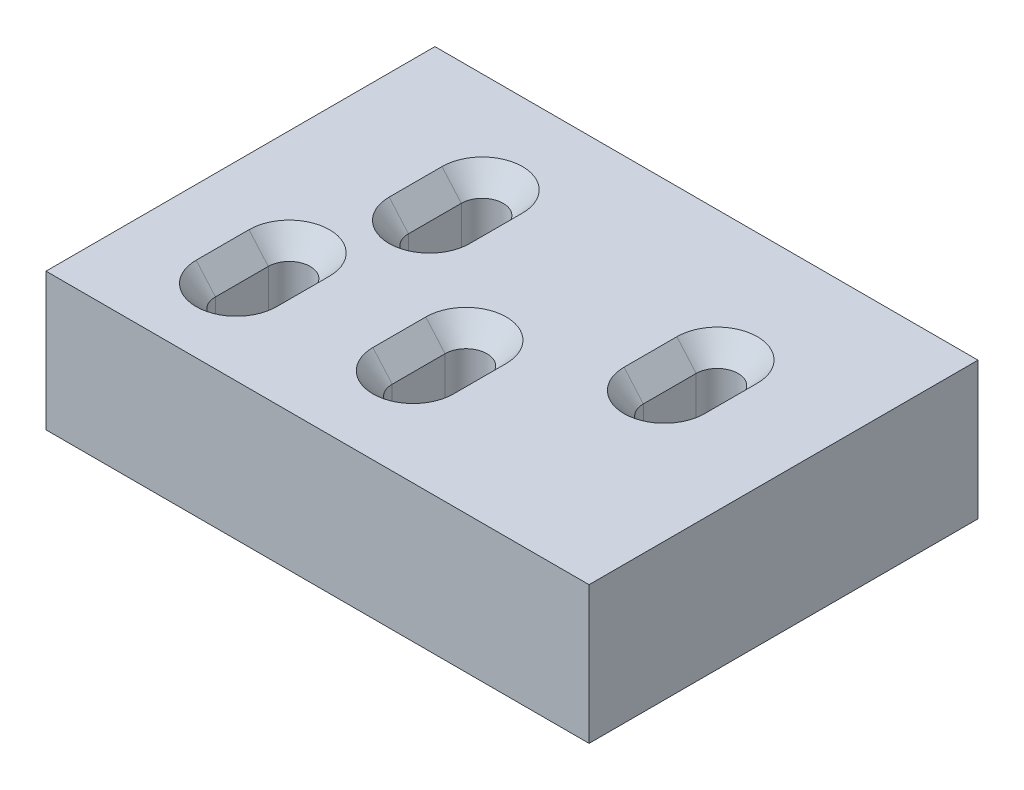
from build123d import *

# Parameters (mm, degrees)
SKETCH1_W                                      = 130.554298298
SKETCH1_H                                      = 93.497401401
BOSS_EXTRUDE1_DEPTH                            = 33.046022073
CSK_SLOT_FOR_3_8_FLAT_HEAD_MACHINE_SCREW_DEPTH = 33.046022073


with BuildPart() as part:
    # Sketch1 → Boss-Extrude1 (new body)
    with BuildSketch(Plane(origin=(0, 0, 0), x_dir=(1, 0, 0), z_dir=(0, 1, 0))):
        with Locations((65.277149149, 46.748700701)):
            Rectangle(SKETCH1_W, SKETCH1_H)
    extrude(amount=BOSS_EXTRUDE1_DEPTH)

    # CSK SLOT for 3/8 Flat Head Machine Screw1: read off the stored shape, not the designer's step
    # CSK SLOT for 3_8 Flat Head Machine S 2 → CSK SLOT for 3/8 Flat Head Machine Screw1 (cut)
    with BuildSketch(Plane(origin=(0, 0, 0), x_dir=(1, 0, 0), z_dir=(0, 1, 0))):
        with BuildLine():
            Line((30.486575013, 20.328472109), (30.486575013, 33.028472109))
            ThreePointArc((30.486575013, 33.028472109), (25.444675013, 38.070372109), (20.402775013, 33.028472109))
            Line((20.402775013, 33.028472109), (20.402775013, 20.328472109))
            ThreePointArc((20.402775013, 20.328472109), (25.444675013, 15.286572109), (30.486575013, 20.328472109))
        make_face()
        with BuildLine():
            Line((69.908405086, 23.408302584), (69.908405086, 36.108302584))
            ThreePointArc((69.908405086, 36.108302584), (64.866505086, 41.150202584), (59.824605086, 36.108302584))
            Line((59.824605086, 36.108302584), (59.824605086, 23.408302584))
            ThreePointArc((59.824605086, 23.408302584), (64.866505086, 18.366402584), (69.908405086, 23.408302584))
        make_face()
        with BuildLine():
            Line((104.197184368, 49.4842006), (104.197184368, 62.1842006))
            ThreePointArc((104.197184368, 62.1842006), (99.155284368, 67.2261006), (94.113384368, 62.1842006))
            Line((94.113384368, 62.1842006), (94.113384368, 49.4842006))
            ThreePointArc((94.113384368, 49.4842006), (99.155284368, 44.4423006), (104.197184368, 49.4842006))
        make_face()
        with BuildLine():
            Line((40.547354563, 56.670471707), (40.547354563, 69.370471707))
            ThreePointArc((40.547354563, 69.370471707), (35.505454563, 74.412371707), (30.463554563, 69.370471707))
            Line((30.463554563, 69.370471707), (30.463554563, 56.670471707))
            ThreePointArc((30.463554563, 56.670471707), (35.505454563, 51.628571707), (40.547354563, 56.670471707))
        make_face()
    extrude(amount=CSK_SLOT_FOR_3_8_FLAT_HEAD_MACHINE_SCREW_DEPTH, mode=Mode.SUBTRACT)

    # CSK SLOT for 3_8 Flat Head Machine S 3: loft between two sections, ruled curve by curve
    csk_slot_for_3_8_flat_head_machine_s_3_from = [
        Edge.make_three_point_arc((30.486575013, 27.713489321, -33.028472109), (29.009836693, 27.713489321, -36.593633789), (25.444675013, 27.713489321, -38.070372109)),
        Edge.make_three_point_arc((25.444675013, 27.713489321, -38.070372109), (21.879513333, 27.713489321, -36.593633789), (20.402775013, 27.713489321, -33.028472109)),
        Edge.make_three_point_arc((20.402775013, 27.713489321, -20.328472109), (21.879513333, 27.713489321, -16.763310429), (25.444675013, 27.713489321, -15.286572109)),
        Edge.make_three_point_arc((25.444675013, 27.713489321, -15.286572109), (29.009836693, 27.713489321, -16.763310429), (30.486575013, 27.713489321, -20.328472109)),
        Edge.make_line((20.402775013, 27.713489321, -33.028472109), (20.402775013, 27.713489321, -20.328472109)),
        Edge.make_line((30.486575013, 27.713489321, -33.028472109), (30.486575013, 27.713489321, -20.328472109)),
    ]
    csk_slot_for_3_8_flat_head_machine_s_3_to = [
        Edge.make_three_point_arc((35.122075013, 33.046022073, -33.028472109), (32.287630178, 33.046022073, -39.871427273), (25.444675013, 33.046022073, -42.705872109)),
        Edge.make_three_point_arc((25.444675013, 33.046022073, -42.705872109), (18.601719849, 33.046022073, -39.871427273), (15.767275013, 33.046022073, -33.028472109)),
        Edge.make_three_point_arc((15.767275013, 33.046022073, -20.328472109), (18.601719849, 33.046022073, -13.485516945), (25.444675013, 33.046022073, -10.651072109)),
        Edge.make_three_point_arc((25.444675013, 33.046022073, -10.651072109), (32.287630178, 33.046022073, -13.485516945), (35.122075013, 33.046022073, -20.328472109)),
        Edge.make_line((15.767275013, 33.046022073, -33.028472109), (15.767275013, 33.046022073, -20.328472109)),
        Edge.make_line((35.122075013, 33.046022073, -33.028472109), (35.122075013, 33.046022073, -20.328472109)),
    ]
    csk_slot_for_3_8_flat_head_machine_s_3 = Solid(Shell([*[Face.make_surface_from_curves(csk_slot_for_3_8_flat_head_machine_s_3_from[k], csk_slot_for_3_8_flat_head_machine_s_3_to[k]) for k in range(6)], Face(Wire(csk_slot_for_3_8_flat_head_machine_s_3_from)), Face(Wire(csk_slot_for_3_8_flat_head_machine_s_3_to))]))
    add(csk_slot_for_3_8_flat_head_machine_s_3, mode=Mode.SUBTRACT)

    # CSK SLOT for 3_8 Flat Head Machine S 4: loft between two sections, ruled curve by curve
    csk_slot_for_3_8_flat_head_machine_s_4_from = [
        Edge.make_three_point_arc((69.908405086, 27.713489321, -36.108302584), (68.431666766, 27.713489321, -39.673464264), (64.866505086, 27.713489321, -41.150202584)),
        Edge.make_three_point_arc((64.866505086, 27.713489321, -41.150202584), (61.301343406, 27.713489321, -39.673464264), (59.824605086, 27.713489321, -36.108302584)),
        Edge.make_three_point_arc((59.824605086, 27.713489321, -23.408302584), (61.301343406, 27.713489321, -19.843140903), (64.866505086, 27.713489321, -18.366402584)),
        Edge.make_three_point_arc((64.866505086, 27.713489321, -18.366402584), (68.431666766, 27.713489321, -19.843140903), (69.908405086, 27.713489321, -23.408302584)),
        Edge.make_line((59.824605086, 27.713489321, -36.108302584), (59.824605086, 27.713489321, -23.408302584)),
        Edge.make_line((69.908405086, 27.713489321, -36.108302584), (69.908405086, 27.713489321, -23.408302584)),
    ]
    csk_slot_for_3_8_flat_head_machine_s_4_to = [
        Edge.make_three_point_arc((74.543905086, 33.046022073, -36.108302584), (71.70946025, 33.046022073, -42.951257748), (64.866505086, 33.046022073, -45.785702584)),
        Edge.make_three_point_arc((64.866505086, 33.046022073, -45.785702584), (58.023549922, 33.046022073, -42.951257748), (55.189105086, 33.046022073, -36.108302584)),
        Edge.make_three_point_arc((55.189105086, 33.046022073, -23.408302584), (58.023549922, 33.046022073, -16.565347419), (64.866505086, 33.046022073, -13.730902584)),
        Edge.make_three_point_arc((64.866505086, 33.046022073, -13.730902584), (71.70946025, 33.046022073, -16.565347419), (74.543905086, 33.046022073, -23.408302584)),
        Edge.make_line((55.189105086, 33.046022073, -36.108302584), (55.189105086, 33.046022073, -23.408302584)),
        Edge.make_line((74.543905086, 33.046022073, -36.108302584), (74.543905086, 33.046022073, -23.408302584)),
    ]
    csk_slot_for_3_8_flat_head_machine_s_4 = Solid(Shell([*[Face.make_surface_from_curves(csk_slot_for_3_8_flat_head_machine_s_4_from[k], csk_slot_for_3_8_flat_head_machine_s_4_to[k]) for k in range(6)], Face(Wire(csk_slot_for_3_8_flat_head_machine_s_4_from)), Face(Wire(csk_slot_for_3_8_flat_head_machine_s_4_to))]))
    add(csk_slot_for_3_8_flat_head_machine_s_4, mode=Mode.SUBTRACT)

    # CSK SLOT for 3_8 Flat Head Machine S 5: loft between two sections, ruled curve by curve
    csk_slot_for_3_8_flat_head_machine_s_5_from = [
        Edge.make_three_point_arc((104.197184368, 27.713489321, -62.1842006), (102.720446048, 27.713489321, -65.74936228), (99.155284368, 27.713489321, -67.2261006)),
        Edge.make_three_point_arc((99.155284368, 27.713489321, -67.2261006), (95.590122688, 27.713489321, -65.74936228), (94.113384368, 27.713489321, -62.1842006)),
        Edge.make_three_point_arc((94.113384368, 27.713489321, -49.4842006), (95.590122688, 27.713489321, -45.91903892), (99.155284368, 27.713489321, -44.4423006)),
        Edge.make_three_point_arc((99.155284368, 27.713489321, -44.4423006), (102.720446048, 27.713489321, -45.91903892), (104.197184368, 27.713489321, -49.4842006)),
        Edge.make_line((94.113384368, 27.713489321, -62.1842006), (94.113384368, 27.713489321, -49.4842006)),
        Edge.make_line((104.197184368, 27.713489321, -62.1842006), (104.197184368, 27.713489321, -49.4842006)),
    ]
    csk_slot_for_3_8_flat_head_machine_s_5_to = [
        Edge.make_three_point_arc((108.832684368, 33.046022073, -62.1842006), (105.998239532, 33.046022073, -69.027155764), (99.155284368, 33.046022073, -71.8616006)),
        Edge.make_three_point_arc((99.155284368, 33.046022073, -71.8616006), (92.312329203, 33.046022073, -69.027155764), (89.477884368, 33.046022073, -62.1842006)),
        Edge.make_three_point_arc((89.477884368, 33.046022073, -49.4842006), (92.312329203, 33.046022073, -42.641245436), (99.155284368, 33.046022073, -39.8068006)),
        Edge.make_three_point_arc((99.155284368, 33.046022073, -39.8068006), (105.998239532, 33.046022073, -42.641245436), (108.832684368, 33.046022073, -49.4842006)),
        Edge.make_line((89.477884368, 33.046022073, -62.1842006), (89.477884368, 33.046022073, -49.4842006)),
        Edge.make_line((108.832684368, 33.046022073, -62.1842006), (108.832684368, 33.046022073, -49.4842006)),
    ]
    csk_slot_for_3_8_flat_head_machine_s_5 = Solid(Shell([*[Face.make_surface_from_curves(csk_slot_for_3_8_flat_head_machine_s_5_from[k], csk_slot_for_3_8_flat_head_machine_s_5_to[k]) for k in range(6)], Face(Wire(csk_slot_for_3_8_flat_head_machine_s_5_from)), Face(Wire(csk_slot_for_3_8_flat_head_machine_s_5_to))]))
    add(csk_slot_for_3_8_flat_head_machine_s_5, mode=Mode.SUBTRACT)

    # CSK SLOT for 3_8 Flat Head Machine S 6: loft between two sections, ruled curve by curve
    csk_slot_for_3_8_flat_head_machine_s_6_from = [
        Edge.make_three_point_arc((40.547354563, 27.713489321, -69.370471707), (39.070616243, 27.713489321, -72.935633387), (35.505454563, 27.713489321, -74.412371707)),
        Edge.make_three_point_arc((35.505454563, 27.713489321, -74.412371707), (31.940292883, 27.713489321, -72.935633387), (30.463554563, 27.713489321, -69.370471707)),
        Edge.make_three_point_arc((30.463554563, 27.713489321, -56.670471707), (31.940292883, 27.713489321, -53.105310027), (35.505454563, 27.713489321, -51.628571707)),
        Edge.make_three_point_arc((35.505454563, 27.713489321, -51.628571707), (39.070616243, 27.713489321, -53.105310027), (40.547354563, 27.713489321, -56.670471707)),
        Edge.make_line((30.463554563, 27.713489321, -69.370471707), (30.463554563, 27.713489321, -56.670471707)),
        Edge.make_line((40.547354563, 27.713489321, -69.370471707), (40.547354563, 27.713489321, -56.670471707)),
    ]
    csk_slot_for_3_8_flat_head_machine_s_6_to = [
        Edge.make_three_point_arc((45.182854563, 33.046022073, -69.370471707), (42.348409727, 33.046022073, -76.213426871), (35.505454563, 33.046022073, -79.047871707)),
        Edge.make_three_point_arc((35.505454563, 33.046022073, -79.047871707), (28.662499399, 33.046022073, -76.213426871), (25.828054563, 33.046022073, -69.370471707)),
        Edge.make_three_point_arc((25.828054563, 33.046022073, -56.670471707), (28.662499399, 33.046022073, -49.827516543), (35.505454563, 33.046022073, -46.993071707)),
        Edge.make_three_point_arc((35.505454563, 33.046022073, -46.993071707), (42.348409727, 33.046022073, -49.827516543), (45.182854563, 33.046022073, -56.670471707)),
        Edge.make_line((25.828054563, 33.046022073, -69.370471707), (25.828054563, 33.046022073, -56.670471707)),
        Edge.make_line((45.182854563, 33.046022073, -69.370471707), (45.182854563, 33.046022073, -56.670471707)),
    ]
    csk_slot_for_3_8_flat_head_machine_s_6 = Solid(Shell([*[Face.make_surface_from_curves(csk_slot_for_3_8_flat_head_machine_s_6_from[k], csk_slot_for_3_8_flat_head_machine_s_6_to[k]) for k in range(6)], Face(Wire(csk_slot_for_3_8_flat_head_machine_s_6_from)), Face(Wire(csk_slot_for_3_8_flat_head_machine_s_6_to))]))
    add(csk_slot_for_3_8_flat_head_machine_s_6, mode=Mode.SUBTRACT)


solid = part.part
